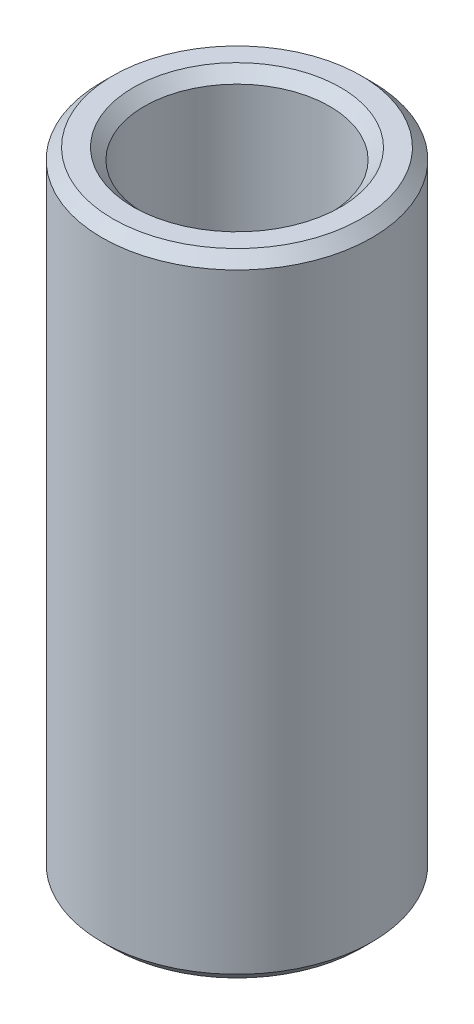
from build123d import *

# Parameters (mm, degrees)
SKETCH1_R           = 45
BOSS_EXTRUDE1_DEPTH = 210.612073648
SKETCH2_R           = 30.914596304
CUT_EXTRUDE1_DEPTH  = 221.01692109
CHAMFER1_SIZE       = 3.631143054


with BuildPart() as part:
    # Sketch1 → Boss-Extrude1 (new body)
    with BuildSketch(Plane(origin=(0, 0, 0), x_dir=(1, 0, 0), z_dir=(0, 1, 0))):
        Circle(SKETCH1_R)
    extrude(amount=BOSS_EXTRUDE1_DEPTH)

    # Sketch2 → Cut-Extrude1 (cut, through all)
    with BuildSketch(Plane(origin=(0, 0, 0), x_dir=(1, 0, 0), z_dir=(0, 1, 0))):
        Circle(SKETCH2_R)
    extrude(amount=CUT_EXTRUDE1_DEPTH, mode=Mode.SUBTRACT)

    # Chamfer1
    chamfer1_edges = [part.edges().sort_by_distance(p)[0] for p in [
        (-30.914596304, 210.612073648, 0),
        (-30.914596304, 0, 0),
        (-45, 0, 0),
        (-45, 210.612073648, 0),
    ]]
    chamfer(chamfer1_edges, length=CHAMFER1_SIZE)


solid = part.part
